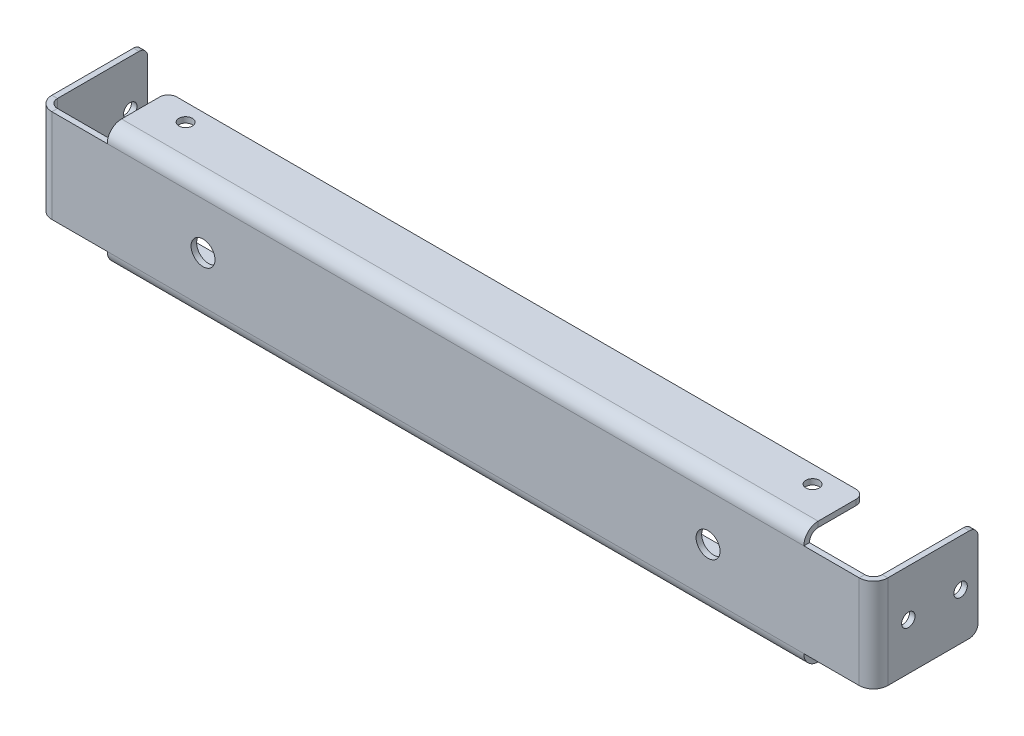
from build123d import *

# Parameters (mm, degrees)
BASE_FLANGE1_DEPTH           = 254
SKETCH6_W                    = 2.032
SKETCH6_H                    = 34.036
BOSS_EXTRUDE1_DEPTH          = 25.4
EDGE_FLANGE1_STRIP_W         = 14.478
EDGE_FLANGE1_STRIP_H         = 2.032
EDGE_FLANGE1_STRIP_CUT_DEPTH = 34.036
EDGE_FLANGE1_DEPTH           = 34.036
SKETCH10_R                   = 2.4511
CUT_EXTRUDE1_DEPTH           = 311.37147501
SKETCH11_R                   = 2.4511
CUT_EXTRUDE2_DEPTH           = 286.467638271
SKETCH12_R                   = 4.3688
CUT_EXTRUDE3_DEPTH           = 286.467638271
FILLET1_R                    = 3.175


# Sheet-metal steps are written as plain solids
with BuildPart() as part:
    # Sketch1 → Base-Flange1 (new body)
    with BuildSketch(Plane(origin=(0, 0, 0), x_dir=(0, 0, -1), z_dir=(1, 0, 0))):
        with BuildLine():
            Line((22.225, 0), (5.207, 0))
            ThreePointArc((5.207, 0), (1.52509499, 1.52509499), (0, 5.207))
            Line((0, 5.207), (0, 39.243))
            ThreePointArc((0, 39.243), (1.52509499, 42.92490501), (5.207, 44.45))
            Line((5.207, 44.45), (22.225, 44.45))
            Line((22.225, 44.45), (22.225, 42.418))
            Line((22.225, 42.418), (5.207, 42.418))
            ThreePointArc((5.207, 42.418), (2.96193597, 41.48806403), (2.032, 39.243))
            Line((2.032, 39.243), (2.032, 5.207))
            ThreePointArc((2.032, 5.207), (2.96193597, 2.96193597), (5.207, 2.032))
            Line((5.207, 2.032), (22.225, 2.032))
            Line((22.225, 2.032), (22.225, 0))
        make_face()
    extrude(amount=BASE_FLANGE1_DEPTH)

    # Sketch6 → Boss-Extrude1 (add)
    with BuildSketch(Plane(origin=(254, 0, 0), x_dir=(0, 0, -1), z_dir=(1, 0, 0))):
        with Locations((1.016, 22.225)):
            Rectangle(SKETCH6_W, SKETCH6_H)
    boss_extrude1 = extrude(amount=BOSS_EXTRUDE1_DEPTH)

    # Edge-Flange1 strip (across the edge) → Edge-Flange1 strip cut (cut)
    with BuildSketch(Plane(origin=(279.4, 39.243, -2.032), x_dir=(-1, 0, 0), z_dir=(0, -1, 0))):
        with Locations((-2.032, -1.016)):
            Rectangle(EDGE_FLANGE1_STRIP_W, EDGE_FLANGE1_STRIP_H)
    edge_flange1_strip_cut = extrude(amount=EDGE_FLANGE1_STRIP_CUT_DEPTH, mode=Mode.SUBTRACT)

    # Edge-Flange1 section (across the edge) → Edge-Flange1 (add)
    with BuildSketch(Plane(origin=(279.4, 39.243, -2.032), x_dir=(-1, 0, 0), z_dir=(0, -1, 0))):
        with BuildLine():
            Line((0, 3.175), (0, 36.068))
            Line((0, 36.068), (2.032, 36.068))
            Line((2.032, 36.068), (2.032, 3.175))
            ThreePointArc((2.032, 3.175), (2.96193597, 0.92993597), (5.207, 0))
            Line((5.207, 0), (5.207, -2.032))
            ThreePointArc((5.207, -2.032), (1.52509499, -0.50690501), (0, 3.175))
        make_face()
    edge_flange1 = extrude(amount=EDGE_FLANGE1_DEPTH)

    # Mirror1: Boss-Extrude1, Edge-Flange1 strip cut, Edge-Flange1 across plane
    add(boss_extrude1.mirror(Plane(origin=(127, 0, 0), x_dir=(0, 0, 1), z_dir=(1, 0, 0))))
    add(edge_flange1_strip_cut.mirror(Plane(origin=(127, 0, 0), x_dir=(0, 0, 1), z_dir=(1, 0, 0))), mode=Mode.SUBTRACT)
    add(edge_flange1.mirror(Plane(origin=(127, 0, 0), x_dir=(0, 0, 1), z_dir=(1, 0, 0))))

    # Sketch10 → Cut-Extrude1 (cut, through all)
    with BuildSketch(Plane(origin=(279.4, 0, 0), x_dir=(0, 0, -1), z_dir=(1, 0, 0))):
        with Locations((12.7, 22.225)):
            Circle(SKETCH10_R)
        with Locations((31.75, 22.225)):
            Circle(SKETCH10_R)
    extrude(amount=-CUT_EXTRUDE1_DEPTH, mode=Mode.SUBTRACT)

    # Sketch11 → Cut-Extrude2 (cut, through all)
    with BuildSketch(Plane(origin=(0, 44.45, 0), x_dir=(1, 0, 0), z_dir=(0, 1, 0))):
        with Locations(Location((12.7, 15.875, 0), (0, 0, 270))):
            Circle(SKETCH11_R)
        with Locations(Location((241.3, 15.875, 0), (0, 0, 270))):
            Circle(SKETCH11_R)
    extrude(amount=-CUT_EXTRUDE2_DEPTH, mode=Mode.SUBTRACT)

    # Sketch12 → Cut-Extrude3 (cut, through all)
    with BuildSketch(Plane.XY):
        with Locations((34.925, 22.225)):
            Circle(SKETCH12_R)
        with Locations((219.075, 22.225)):
            Circle(SKETCH12_R)
    extrude(amount=-CUT_EXTRUDE3_DEPTH, mode=Mode.SUBTRACT)

    # Fillet1
    fillet1_edges = [part.edges().sort_by_distance(p)[0] for p in [
        (-24.384, 5.207, -38.1),
        (0, 1.016, -22.225),
        (-24.384, 39.243, -38.1),
        (0, 43.434, -22.225),
        (254, 1.016, -22.225),
        (278.384, 39.243, -38.1),
        (278.384, 5.207, -38.1),
        (254, 43.434, -22.225),
    ]]
    fillet(fillet1_edges, radius=FILLET1_R)


solid = part.part
